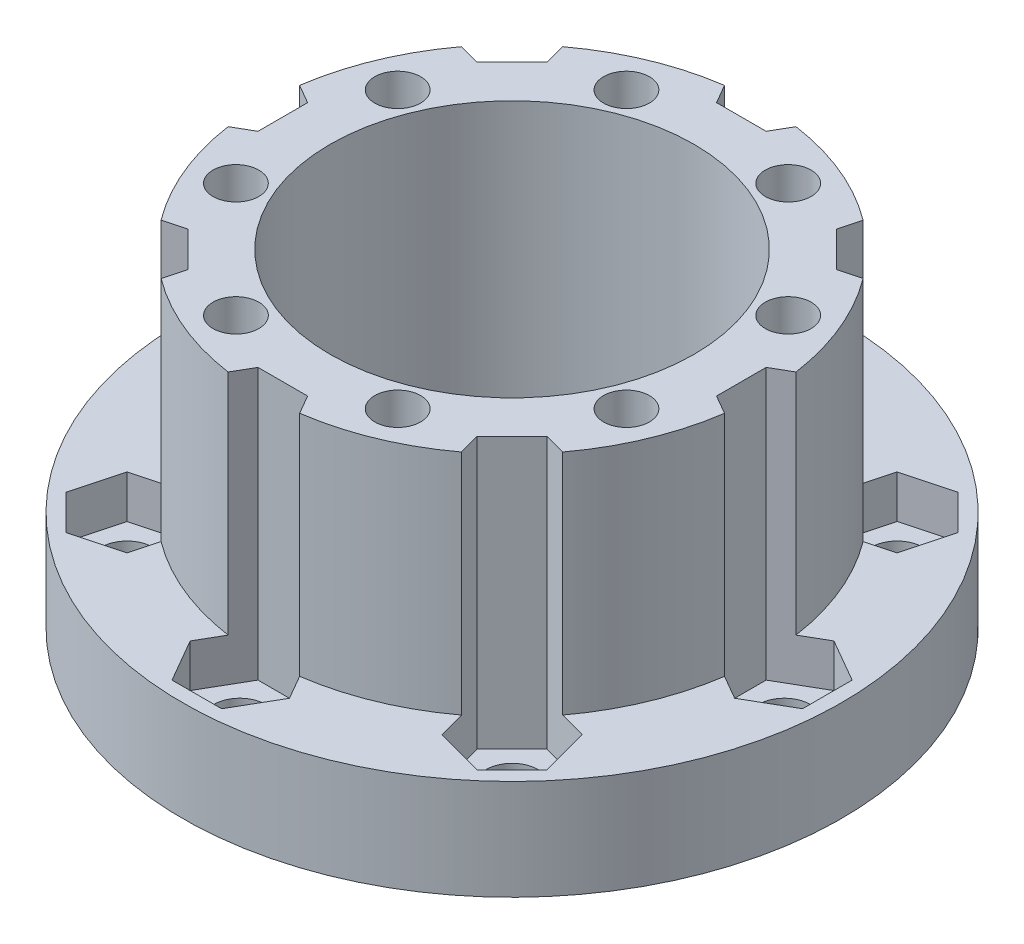
from build123d import *

# Parameters (mm, degrees)
SKETCH_2_R               = 1.8
CUT_EXTRUDE_1_DEPTH      = 8
CUT_EXTRUDE_START        = -3
CUT_EXTRUDE_3_DEPTH      = 41.175260591
PATTERN_CIRCULAR_1_COUNT = 8
SKETCH_3_R               = 1.55
CUT_EXTRUDE_2_DEPTH      = 10
CUT_EXTRUDE_4_DEPTH      = 43.272922776
CUT_EXTRUDE_4_DEPTH_BACK = 43.272922776
SKETCH_5_W               = 35
SKETCH_5_H               = 0.1
SKETCH_6_R               = 1.6
CUT_EXTRUDE_5_DEPTH      = 43.272922776
PATTERN_CIRCULAR_2_COUNT = 8
SKETCH_7_R               = 12.7
CUT_EXTRUDE_6_DEPTH      = 41.963520357


with BuildPart() as part:
    # 草图1 → 旋转1 (revolve)
    with BuildSketch(Plane.XY):
        Polygon((-12, 0), (-16.9, 0), (-16.9, 2), (-23, 2), (-23, 9), (-17.5, 9), (-17.5, 27), (-6.75, 27), (-6.75, 25), (-12, 25), align=None)
    revolve(axis=Axis((0, 0, 0), (0, 1, 0)))

    # 草图2 → 切除-拉伸1 (cut)
    with BuildSketch(Plane.XZ.offset(-2)):
        with Locations((0, -19)):
            Circle(SKETCH_2_R)
    cut_extrude_1 = extrude(amount=-CUT_EXTRUDE_1_DEPTH, mode=Mode.SUBTRACT)

    # 草图4 → 切除-拉伸3 (cut)
    with BuildSketch(Plane(origin=(0, 9, 0), x_dir=(1, 0, 0), z_dir=(0, 1, 0)).offset(CUT_EXTRUDE_START)):
        Polygon((-1.732050808, 22), (-3.464101615, 19), (-1.732050808, 16), (1.732050808, 16), (3.464101615, 19), (1.732050808, 22), align=None)
    cut_extrude_3 = extrude(amount=CUT_EXTRUDE_3_DEPTH, mode=Mode.SUBTRACT)

    # 阵列(圆周)1: 切除-拉伸1, 切除-拉伸3 ×8 about axis
    pattern_circular_1_axis = Axis((0, 2, 0), (0, -1, 0))
    add([cut_extrude_1.rotate(pattern_circular_1_axis, i * 360 / PATTERN_CIRCULAR_1_COUNT) for i in range(1, PATTERN_CIRCULAR_1_COUNT)], mode=Mode.SUBTRACT)
    add([cut_extrude_3.rotate(pattern_circular_1_axis, i * 360 / PATTERN_CIRCULAR_1_COUNT) for i in range(1, PATTERN_CIRCULAR_1_COUNT)], mode=Mode.SUBTRACT)

    # 草图3 → 切除-拉伸2 (cut)
    with BuildSketch(Plane(origin=(0, 27, 0), x_dir=(1, 0, 0), z_dir=(0, 1, 0))):
        with Locations((0, -9.5)):
            Circle(SKETCH_3_R)
        with Locations((-8.227241336, 4.75)):
            Circle(SKETCH_3_R)
        with Locations((8.227241336, 4.75)):
            Circle(SKETCH_3_R)
    extrude(amount=-CUT_EXTRUDE_2_DEPTH, mode=Mode.SUBTRACT)

    # 草图5 → 切除-拉伸4 (cut, two sides: drawn at the far end of the back side and taken through both)
    with BuildSketch(Plane.XY.offset(-CUT_EXTRUDE_4_DEPTH_BACK)):
        with Locations((0, 24.95)):
            Rectangle(SKETCH_5_W, SKETCH_5_H)
    extrude(amount=CUT_EXTRUDE_4_DEPTH + CUT_EXTRUDE_4_DEPTH_BACK, mode=Mode.SUBTRACT)


with BuildPart() as cut_extrude_4_piece_1:
    # of the separate pieces the step leaves, piece 1, a body of its own (cut_extrude_4_pieces)
    add(part.part.solids().sort_by_distance((-12, 0, 0))[0])


with BuildPart() as cut_extrude_4_piece_2:
    # of the separate pieces the step leaves, piece 2, a body of its own (cut_extrude_4_pieces)
    add(part.part.solids().sort_by_distance((-6.677241336, 25, -4.75))[0])


with BuildPart() as cut_extrude_5_tool:
    # 草图6 → 切除-拉伸5 (new, through all)
    with BuildSketch(Plane(origin=(0, 27, 0), x_dir=(1, 0, 0), z_dir=(0, 1, 0))):
        with Locations((5.644580627, 13.627223105)):
            Circle(SKETCH_6_R)
    cut_extrude_5 = extrude(amount=-CUT_EXTRUDE_5_DEPTH)


with BuildPart() as cut_extrude_4_piece_1_1:
    add(cut_extrude_4_piece_1.part)

    # 切除-拉伸5: cut by cut_extrude_5_tool
    add(cut_extrude_5_tool.part, mode=Mode.SUBTRACT)


with BuildPart() as cut_extrude_4_piece_2_1:
    add(cut_extrude_4_piece_2.part)

    # 切除-拉伸5: cut by cut_extrude_5_tool
    add(cut_extrude_5_tool.part, mode=Mode.SUBTRACT)


with BuildPart() as pattern_circular_2_tool:
    # 阵列(圆周)2: 切除-拉伸5 ×8 about axis
    pattern_circular_2_axis = Axis((0, 0, 0), (0, -1, 0))
    for i in range(1, PATTERN_CIRCULAR_2_COUNT):
        add(cut_extrude_5.rotate(pattern_circular_2_axis, i * 360 / PATTERN_CIRCULAR_2_COUNT))


with BuildPart() as cut_extrude_4_piece_1_2:
    add(cut_extrude_4_piece_1_1.part)

    # 阵列(圆周)2: cut by pattern_circular_2_tool
    add(pattern_circular_2_tool.part, mode=Mode.SUBTRACT)

    # 草图7 → 切除-拉伸6 (cut, through all)
    with BuildSketch(Plane(origin=(0, 24.9, 0), x_dir=(1, 0, 0), z_dir=(0, 1, 0))):
        Circle(SKETCH_7_R)
    extrude(amount=-CUT_EXTRUDE_6_DEPTH, mode=Mode.SUBTRACT)


with BuildPart() as cut_extrude_4_piece_2_2:
    add(cut_extrude_4_piece_2_1.part)

    # 阵列(圆周)2: cut by pattern_circular_2_tool
    add(pattern_circular_2_tool.part, mode=Mode.SUBTRACT)


solid = cut_extrude_4_piece_1_2.part
